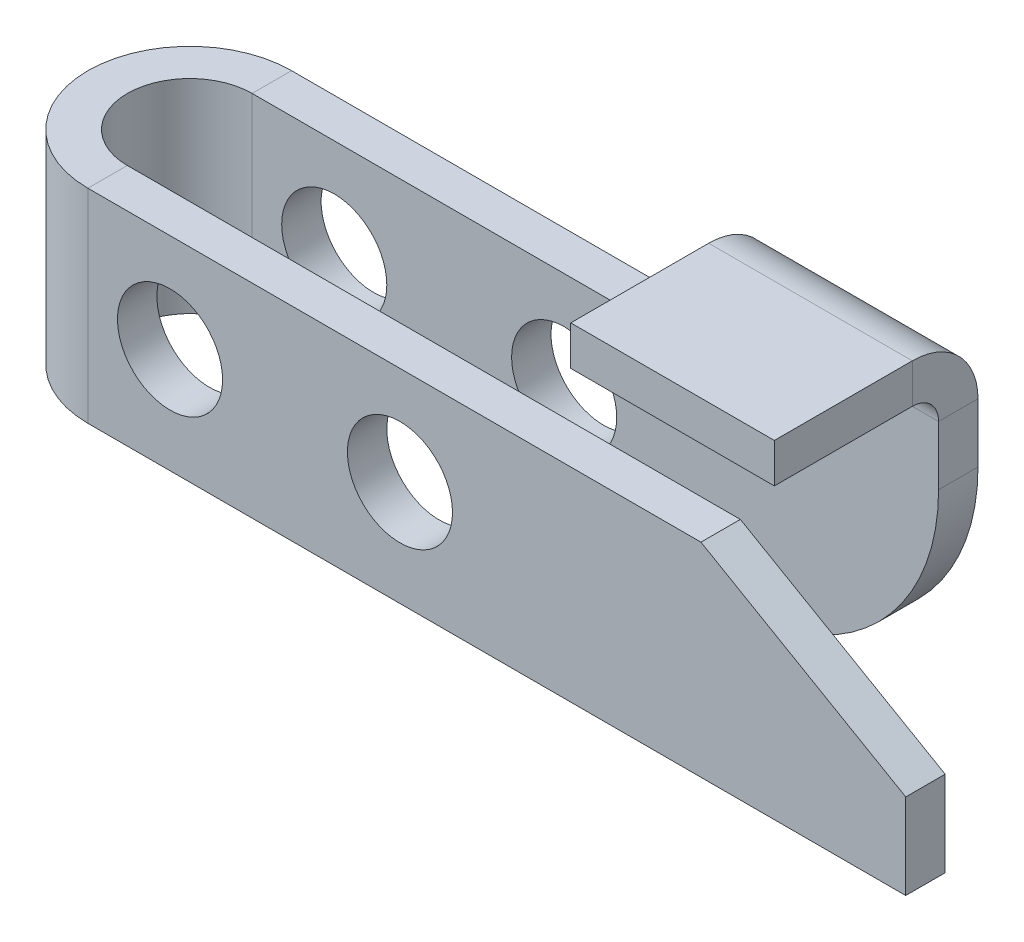
from build123d import *

# Parameters (mm, degrees)
SKETCH_1_W             = 140
SKETCH_1_H             = 31
SM_BASE_FLANGE_1_DEPTH = 6
OTHER_1_DEPTH          = 31
OTHER_1_2_DEPTH        = 31
SM_EDGE_FLANGE_1_DEPTH = 104.5
SKETCH_21_W            = 73.5
SKETCH_21_H            = 19
CUT_EXTRUDE_1_DEPTH    = 152.858486756
SKETCH_22_R            = 8
CUT_EXTRUDE_2_DEPTH    = 152.858486756
CHAMFER_1_SIZE         = 18
CHAMFER_1_SIZE2        = 31.176914536
FILLET_1_R             = 31


# Read off the part's stored shape, not the designer's step: 褶边1
# Sheet-metal steps are written as plain solids
with BuildPart() as part:
    # Sketch 1 → 基体-法兰1 (new body)
    with BuildSketch(Plane.XY):
        with Locations((-70, 15.5)):
            Rectangle(SKETCH_1_W, SKETCH_1_H)
    extrude(amount=-SM_BASE_FLANGE_1_DEPTH)

    # Other 1 outline → Other 1 (cut)
    with BuildSketch(Plane(origin=(0, 0, 0), x_dir=(1, 0, 0), z_dir=(0, 1, 0))):
        with BuildLine():
            ThreePointArc((-124.5, 0), (-131.319090848, 1.580589093), (-136.747448714, 6))
            Line((-136.747448714, 6), (-140, 6))
            Line((-140, 6), (-140, 0))
            Line((-140, 0), (-124.5, 0))
        make_face()
    extrude(amount=OTHER_1_DEPTH, mode=Mode.SUBTRACT)

    # Other 1 2 outline → Other 1 2 (add)
    with BuildSketch(Plane(origin=(0, 0, 0), x_dir=(1, 0, 0), z_dir=(0, 1, 0))):
        with BuildLine():
            Line((-20, 25), (-20, 31))
            Line((-20, 31), (-124.5, 31))
            ThreePointArc((-124.5, 31), (-138.419410907, 22.319090848), (-136.747448714, 6))
            Line((-136.747448714, 6), (-124.5, 6))
            ThreePointArc((-124.5, 6), (-134, 15.5), (-124.5, 25))
            Line((-124.5, 25), (-20, 25))
        make_face()
    extrude(amount=OTHER_1_2_DEPTH)

    # 边线-法兰1 section (across the edge) → 边线-法兰1 (add)
    with BuildSketch(Plane(origin=(-20, 44, -25), x_dir=(0, -1, 0), z_dir=(-1, 0, 0))):
        with BuildLine():
            Line((-6, 4), (-6, 25))
            Line((-6, 25), (0, 25))
            Line((0, 25), (0, 4))
            ThreePointArc((0, 4), (1.171572875, 1.171572875), (4, 0))
            Line((4, 0), (13, 0))
            Line((13, 0), (13, -6))
            Line((13, -6), (4, -6))
            ThreePointArc((4, -6), (-3.071067812, -3.071067812), (-6, 4))
        make_face()
    extrude(amount=SM_EDGE_FLANGE_1_DEPTH)

    # 草图21 → 切除-拉伸1 (cut, through all)
    with BuildSketch(Plane.XY):
        with Locations((-87.75, 40.5)):
            Rectangle(SKETCH_21_W, SKETCH_21_H)
    extrude(amount=-CUT_EXTRUDE_1_DEPTH, mode=Mode.SUBTRACT)

    # 草图22 → 切除-拉伸2 (cut, through all)
    with BuildSketch(Plane.XY):
        with Locations((-112, 16)):
            Circle(SKETCH_22_R)
        with Locations((-77, 16)):
            Circle(SKETCH_22_R)
    extrude(amount=-CUT_EXTRUDE_2_DEPTH, mode=Mode.SUBTRACT)

    # 倒角1
    chamfer_1_edges = [part.edges().sort_by_distance(p)[0] for p in [
        (0, 31, -3),
    ]]
    chamfer_1_side = [part.faces().sort_by_distance(p)[0] for p in [
        (0, 15.5, -3),
    ]]
    chamfer(chamfer_1_edges, length=CHAMFER_1_SIZE, length2=CHAMFER_1_SIZE2, reference=chamfer_1_side[0])

    # 圆角1
    fillet_1_edges = [part.edges().sort_by_distance(p)[0] for p in [
        (-20, 0, -28),
    ]]
    fillet(fillet_1_edges, radius=FILLET_1_R)


solid = part.part
